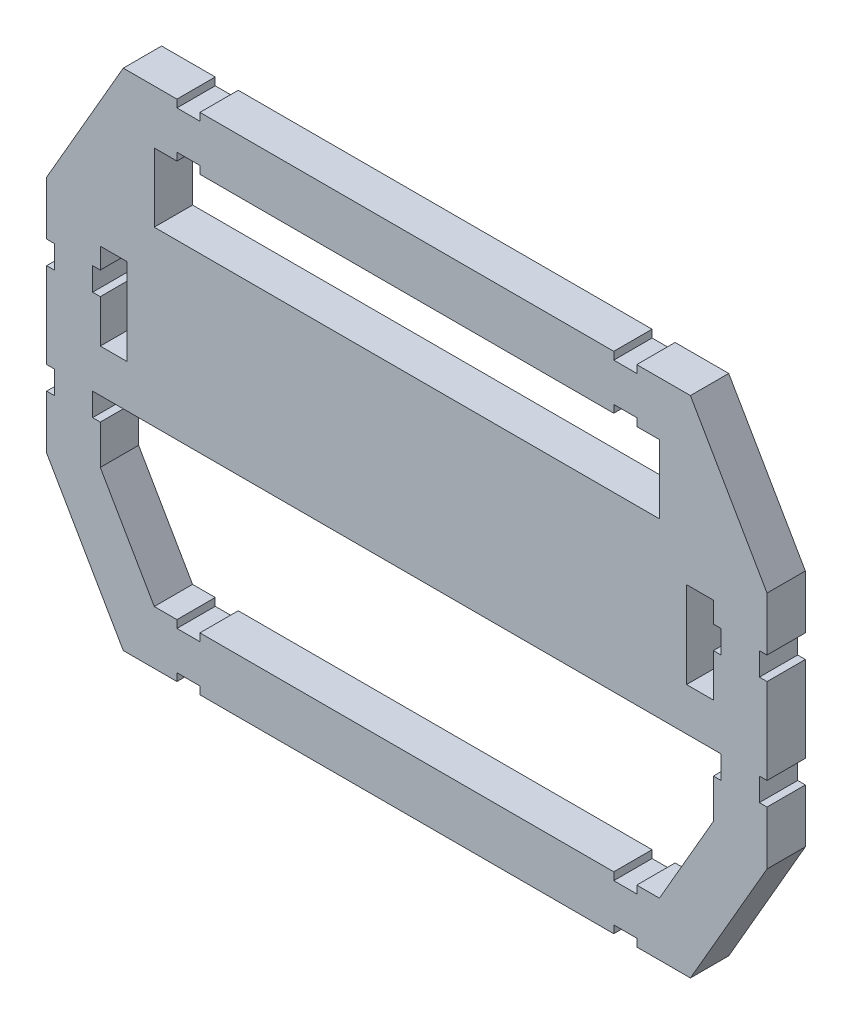
from build123d import *

# Parameters (mm, degrees)
BOSS_EXTRU_1_DEPTH = 5


with BuildPart() as part:
    # Esquisse1 → Boss.-Extru.1 (new body)
    with BuildSketch(Plane.XY):
        Polygon((-32, -30.022213998), (22, -30.022213998), (22, -29.022213998), (25, -29.022213998), (25, -30.022213998), (32, -30.022213998), (42, -12.701705922), (42, -5.701705922), (41, -5.701705922), (41, -2.701705922), (42, -2.701705922), (42, 8.475208614), (41, 8.475208614), (41, 11.475208614), (42, 11.475208614), (42, 18.475208614), (32, 35.79571669), (25, 35.79571669), (25, 34.79571669), (22, 34.79571669), (22, 35.79571669), (-32, 35.79571669), (-32, 34.79571669), (-35, 34.79571669), (-35, 35.79571669), (-42, 35.79571669), (-52, 18.475208614), (-52, 11.475208614), (-51, 11.475208614), (-51, 8.475208614), (-52, 8.475208614), (-52, -2.701705922), (-51, -2.701705922), (-51, -5.701705922), (-52, -5.701705922), (-52, -12.701705922), (-42, -30.022213998), (-35, -30.022213998), (-35, -29.022213998), (-32, -29.022213998), align=None)
        Polygon((-46, -2.701705922), (-45, -2.701705922), (35, -2.701705922), (36, -2.701705922), (36, -5.701705922), (35, -5.701705922), (35, -10.826061575), (27.958548116, -23.022213998), (25, -23.022213998), (25, -24.022213998), (22, -24.022213998), (22, -23.022213998), (-32, -23.022213998), (-32, -24.022213998), (-35, -24.022213998), (-35, -23.022213998), (-37.958548116, -23.022213998), (-45, -10.826061575), (-45, -5.701705922), (-46, -5.701705922), align=None, mode=Mode.SUBTRACT)
        Polygon((-45, 2.886751346), (-45, 8.475208614), (-46, 8.475208614), (-46, 11.475208614), (-45, 11.475208614), (-45, 14.177208614), (-41.5, 14.177208614), (-41.5, 2.886751346), align=None, mode=Mode.SUBTRACT)
        Polygon((-32, 29.79571669), (-32, 28.79571669), (22, 28.79571669), (22, 29.79571669), (25, 29.79571669), (25, 28.79571669), (27.958548116, 28.79571669), (27.958548116, 19.842608257), (-37.958548116, 19.842608257), (-37.958548116, 28.79571669), (-35, 28.79571669), (-35, 29.79571669), align=None, mode=Mode.SUBTRACT)
        Polygon((35, 8.475208614), (35, 2.886751346), (31.5, 2.886751346), (31.5, 14.177208614), (35, 14.177208614), (35, 11.475208614), (36, 11.475208614), (36, 8.475208614), align=None, mode=Mode.SUBTRACT)
    extrude(amount=BOSS_EXTRU_1_DEPTH)


solid = part.part
